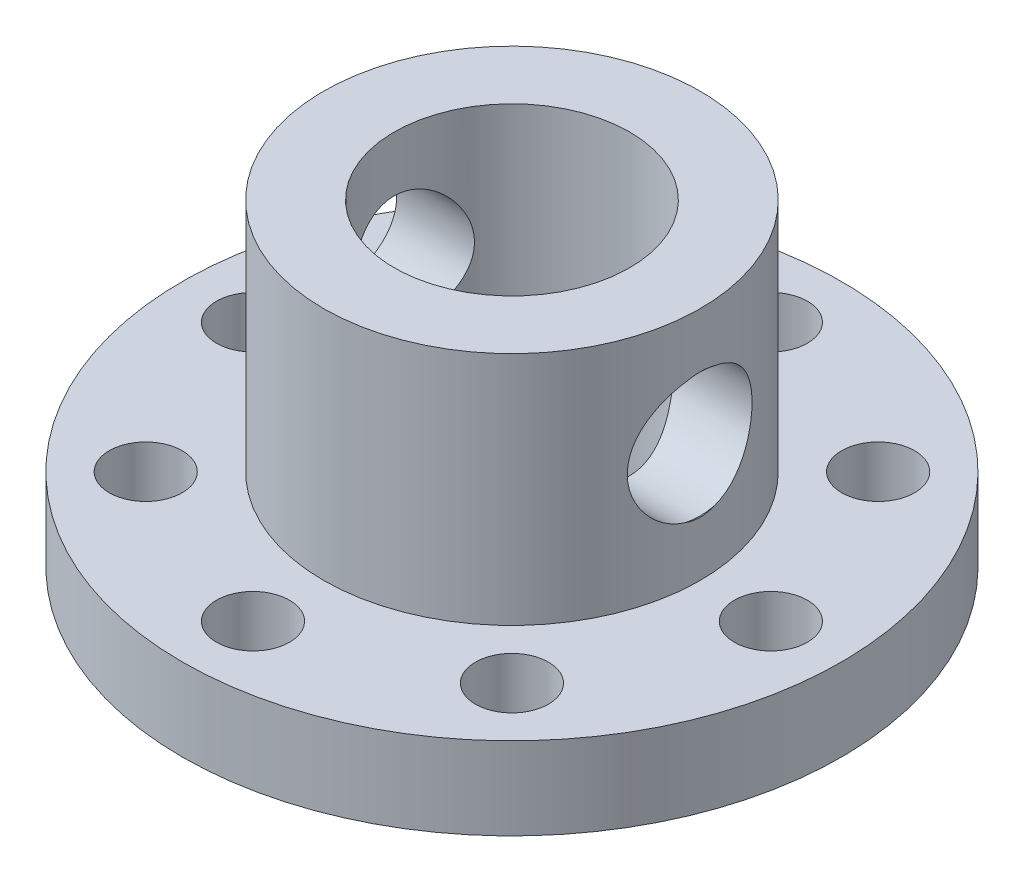
from build123d import *

# Parameters (mm, degrees)
SKETCH1_R                      = 14
BOSS_EXTRUDE1_DEPTH            = 1.75
M2_5_CLEARANCE_HOLE1_D         = 3.1
M2_5_CLEARANCE_HOLE1_DEPTH     = 6
M2_5_CLEARANCE_HOLE1_TIP       = 0.931333959
SKETCH9_R                      = 8
BOSS_EXTRUDE2_DEPTH            = 10
SKETCH7_R                      = 5
CUT_EXTRUDE1_DEPTH             = 24.963513933
M5_CLEARANCE_HOLE1_D           = 5.3
M5_CLEARANCE_HOLE1_DEPTH       = 25.4
M5_CLEARANCE_HOLE1_CSINK_D     = 5.35
M5_CLEARANCE_HOLE1_CSINK_ANGLE = 90
M5_CLEARANCE_HOLE1_TIP         = 1.59228064


with BuildPart() as part:
    # Sketch1 → Boss-Extrude1 (new, symmetric)
    with BuildSketch(Plane(origin=(0, 0, 0), x_dir=(1, 0, 0), z_dir=(0, 1, 0))):
        Circle(SKETCH1_R)
    extrude(amount=BOSS_EXTRUDE1_DEPTH, both=True)

    # M2.5 Clearance Hole1
    with Locations(Plane(origin=(0, 1.75, 0), x_dir=(1, 0, 0), z_dir=(0, 1, 0))):
        with Locations((-11, 0), (-7.778174593, 7.778174593), (0, 11), (7.778174593, 7.778174593), (11, 0), (7.778174593, -7.778174593), (0, -11), (-7.778174593, -7.778174593)):
            Hole(M2_5_CLEARANCE_HOLE1_D / 2, depth=M2_5_CLEARANCE_HOLE1_DEPTH)
            with Locations((0, 0, -(M2_5_CLEARANCE_HOLE1_DEPTH + M2_5_CLEARANCE_HOLE1_TIP / 2))):  # 118° drill point
                Cone(0, M2_5_CLEARANCE_HOLE1_D / 2, M2_5_CLEARANCE_HOLE1_TIP, mode=Mode.SUBTRACT)

    # Sketch9 → Boss-Extrude2 (add)
    with BuildSketch(Plane(origin=(0, 1.75, 0), x_dir=(1, 0, 0), z_dir=(0, 1, 0))):
        Circle(SKETCH9_R)
    extrude(amount=BOSS_EXTRUDE2_DEPTH)

    # Sketch7 → Cut-Extrude1 (cut, through all)
    with BuildSketch(Plane.XZ.offset(1.75)):
        Circle(SKETCH7_R)
    extrude(amount=-CUT_EXTRUDE1_DEPTH, mode=Mode.SUBTRACT)

    # M5 Clearance Hole1
    with Locations(Plane(origin=(8, 0, 0), x_dir=(0, 0, -1), z_dir=(1, 0, 0))):
        with Locations((0, 6.75)):
            CounterSinkHole(M5_CLEARANCE_HOLE1_D / 2, M5_CLEARANCE_HOLE1_CSINK_D / 2, depth=M5_CLEARANCE_HOLE1_DEPTH, counter_sink_angle=M5_CLEARANCE_HOLE1_CSINK_ANGLE)
            with Locations((0, 0, -(M5_CLEARANCE_HOLE1_DEPTH + M5_CLEARANCE_HOLE1_TIP / 2))):  # 118° drill point
                Cone(0, M5_CLEARANCE_HOLE1_D / 2, M5_CLEARANCE_HOLE1_TIP, mode=Mode.SUBTRACT)


solid = part.part
